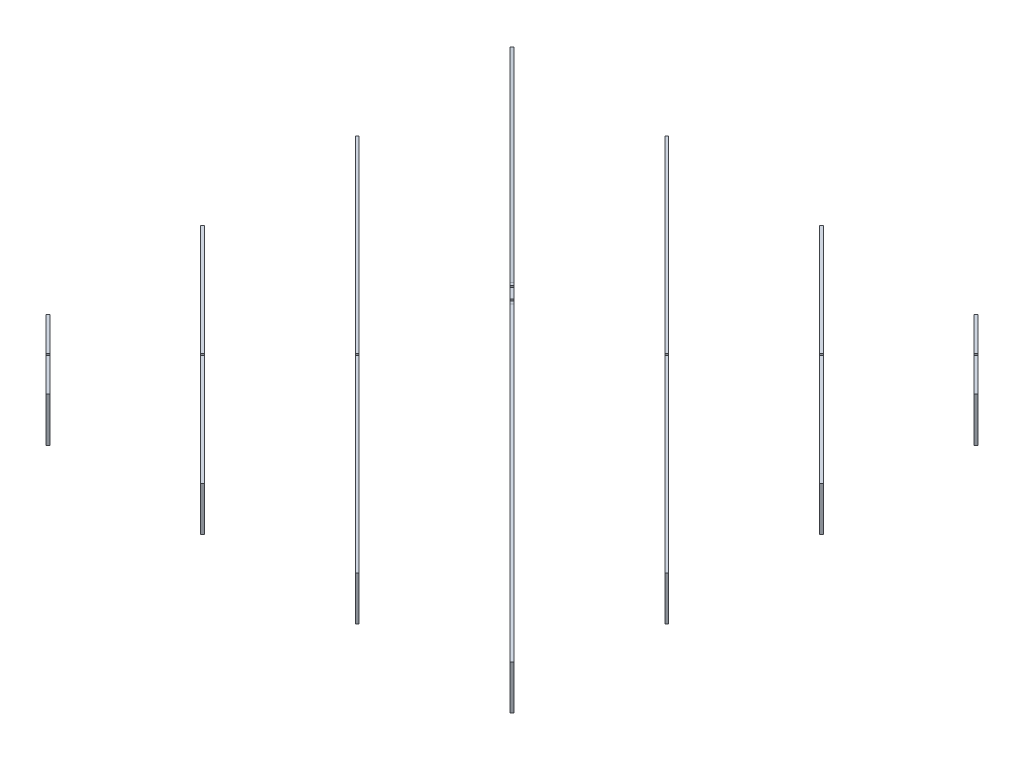
from build123d import *
from OCP.BRepAlgoAPI import BRepAlgoAPI_Cut
from OCP.TopTools import TopTools_ListOfShape

# Parameters (mm, degrees)
BOSS_EXTRUDE1_DEPTH   = 100
BOSS_EXTRUDE1_2_DEPTH = 100
BOSS_EXTRUDE1_3_DEPTH = 100
BOSS_EXTRUDE1_4_DEPTH = 100
BOSS_EXTRUDE1_5_DEPTH = 100
BOSS_EXTRUDE1_6_DEPTH = 100
BOSS_EXTRUDE1_7_DEPTH = 100
BOSS_EXTRUDE2_START   = -6
BOSS_EXTRUDE2_DEPTH   = 6
SKETCH5_R             = 1.5
SKETCH5_W             = 6
SKETCH5_H             = 100
CUT_EXTRUDE2_DEPTH    = 1617.105617821
CUT_EXTRUDE3_START    = -1490.92424
CUT_EXTRUDE3_DEPTH    = 500.97474683
CUT_EXTRUDE4_DEPTH    = 500.974746831
CUT_EXTRUDE5_DEPTH    = 6
CUT_EXTRUDE6_DEPTH    = 887.33661508
SKETCH11_W            = 56
SKETCH11_H            = 12
CUT_EXTRUDE7_DEPTH    = 6
SKETCH12_R            = 4
SKETCH12_R_2          = 10
CUT_EXTRUDE8_DEPTH    = 6
CUT_EXTRUDE9_START    = -6
SKETCH13_R            = 3
CUT_EXTRUDE9_DEPTH    = 253.487373416


with BuildPart() as part:
    # Sketch2 → Boss-Extrude1 (new body)
    with BuildSketch(Plane(origin=(0, 0, 0), x_dir=(1, 0, 0), z_dir=(0, 1, 0))):
        Polygon((-605, -449.242640687), (-449.242640687, -605), (-445, -600.757359313), (-600.757359313, -445), align=None)
    extrude(amount=BOSS_EXTRUDE1_DEPTH)


with BuildPart() as body_2:
    # Sketch2 → Boss-Extrude1 2 (new body)
    with BuildSketch(Plane(origin=(0, 0, 0), x_dir=(1, 0, 0), z_dir=(0, 1, 0))):
        Polygon((-605, -99.242640687), (-99.242640687, -605), (-95, -600.757359313), (-600.757359313, -95), align=None)
    extrude(amount=BOSS_EXTRUDE1_2_DEPTH)


with BuildPart() as body_3:
    # Sketch2 → Boss-Extrude1 3 (new body)
    with BuildSketch(Plane(origin=(0, 0, 0), x_dir=(1, 0, 0), z_dir=(0, 1, 0))):
        Polygon((-605, 250.757359313), (250.757359313, -605), (255, -600.757359313), (-600.757359313, 255), align=None)
    extrude(amount=BOSS_EXTRUDE1_3_DEPTH)


with BuildPart() as body_4:
    # Sketch2 → Boss-Extrude1 4 (new body)
    with BuildSketch(Plane(origin=(0, 0, 0), x_dir=(1, 0, 0), z_dir=(0, 1, 0))):
        Polygon((605, -600.757359313), (-600.757359313, 605), (-605, 600.757359313), (600.757359313, -605), align=None)
    extrude(amount=BOSS_EXTRUDE1_4_DEPTH)

    # Sketch4 → Boss-Extrude2 (add)
    with BuildSketch(Plane(origin=(-2.121320344, 0, 2.121320344), x_dir=(0.7071067811865475, 0, 0.7071067811865477), z_dir=(-0.7071067811865477, 0, 0.7071067811865475)).offset(BOSS_EXTRUDE2_START)):
        Polygon((-30, 220), (-852.599205236, 100), (-30, 100), (30, 100), (852.599205236, 100), (30, 220), align=None)
    extrude(amount=BOSS_EXTRUDE2_DEPTH)


with BuildPart() as body_5:
    # Sketch2 → Boss-Extrude1 5 (new body)
    with BuildSketch(Plane(origin=(0, 0, 0), x_dir=(1, 0, 0), z_dir=(0, 1, 0))):
        Polygon((-255, 600.757359313), (600.757359313, -255), (605, -250.757359313), (-250.757359313, 605), align=None)
    extrude(amount=BOSS_EXTRUDE1_5_DEPTH)


with BuildPart() as body_6:
    # Sketch2 → Boss-Extrude1 6 (new body)
    with BuildSketch(Plane(origin=(0, 0, 0), x_dir=(1, 0, 0), z_dir=(0, 1, 0))):
        Polygon((95, 600.757359313), (600.757359313, 95), (605, 99.242640687), (99.242640687, 605), align=None)
    extrude(amount=BOSS_EXTRUDE1_6_DEPTH)


with BuildPart() as body_7:
    # Sketch2 → Boss-Extrude1 7 (new body)
    with BuildSketch(Plane(origin=(0, 0, 0), x_dir=(1, 0, 0), z_dir=(0, 1, 0))):
        Polygon((445, 600.757359313), (600.757359313, 445), (605, 449.242640687), (449.242640687, 605), align=None)
    extrude(amount=BOSS_EXTRUDE1_7_DEPTH)


with BuildPart() as cut_extrude2_tool:
    # Sketch5 → Cut-Extrude2 (new, through all)
    with BuildSketch(Plane(origin=(-527.121320344, 0, 527.121320344), x_dir=(0.707106781186544, 0, 0.7071067811865511), z_dir=(-0.7071067811865511, 0, 0.707106781186544))):
        with BuildLine():
            Line((-745.462120246, 48.5), (-745.462120246, 50))
            Line((-745.462120246, 50), (-743.962120246, 50))
            ThreePointArc((-743.962120246, 50), (-746.522780418, 51.060660172), (-745.462120246, 48.5))
        make_face()
        with BuildLine():
            Line((-743.962120246, 50), (-745.462120246, 50))
            Line((-745.462120246, 50), (-745.462120246, 48.5))
            ThreePointArc((-745.462120246, 48.5), (-744.401460074, 48.939339828), (-743.962120246, 50))
        make_face()
        with BuildLine():
            ThreePointArc((-737.962120246, 50), (-739.462120246, 51.5), (-740.962120246, 50))
            Line((-740.962120246, 50), (-739.462120246, 50))
            Line((-739.462120246, 50), (-739.462120246, 48.5))
            ThreePointArc((-739.462120246, 48.5), (-738.401460074, 48.939339828), (-737.962120246, 50))
        make_face()
        with BuildLine():
            Line((-739.462120246, 50), (-740.962120246, 50))
            ThreePointArc((-740.962120246, 50), (-740.522780418, 48.939339828), (-739.462120246, 48.5))
            Line((-739.462120246, 48.5), (-739.462120246, 50))
        make_face()
        with BuildLine():
            ThreePointArc((-737.962120246, 50), (-739.462120246, 51.5), (-740.962120246, 50))
            Line((-740.962120246, 50), (-739.462120246, 50))
            Line((-739.462120246, 50), (-739.462120246, 48.5))
            ThreePointArc((-739.462120246, 48.5), (-738.401460074, 48.939339828), (-737.962120246, 50))
        make_face()
        with BuildLine():
            Line((-739.462120246, 50), (-740.962120246, 50))
            ThreePointArc((-740.962120246, 50), (-740.522780418, 48.939339828), (-739.462120246, 48.5))
            Line((-739.462120246, 48.5), (-739.462120246, 50))
        make_face()
        with BuildLine():
            Line((-745.462120246, 48.5), (-745.462120246, 50))
            Line((-745.462120246, 50), (-743.962120246, 50))
            ThreePointArc((-743.962120246, 50), (-746.522780418, 51.060660172), (-745.462120246, 48.5))
        make_face()
        with BuildLine():
            Line((-743.962120246, 50), (-745.462120246, 50))
            Line((-745.462120246, 50), (-745.462120246, 48.5))
            ThreePointArc((-745.462120246, 48.5), (-744.401460074, 48.939339828), (-743.962120246, 50))
        make_face()
        with Locations((-739.462120246, 50)):
            Circle(SKETCH5_R)
        with Locations((-745.462120246, 50)):
            Circle(SKETCH5_R)
        with Locations((-742.462120246, 0)):
            Rectangle(SKETCH5_W, SKETCH5_H)
        with BuildLine():
            ThreePointArc((-490.474746831, 50), (-491.974746831, 51.5), (-493.474746831, 50))
            Line((-493.474746831, 50), (-491.974746831, 50))
            Line((-491.974746831, 50), (-491.974746831, 48.5))
            ThreePointArc((-491.974746831, 48.5), (-490.914086659, 48.939339828), (-490.474746831, 50))
        make_face()
        with BuildLine():
            Line((-491.974746831, 50), (-493.474746831, 50))
            ThreePointArc((-493.474746831, 50), (-493.035407002, 48.939339828), (-491.974746831, 48.5))
            Line((-491.974746831, 48.5), (-491.974746831, 50))
        make_face()
        with BuildLine():
            ThreePointArc((-490.474746831, 50), (-491.974746831, 51.5), (-493.474746831, 50))
            Line((-493.474746831, 50), (-491.974746831, 50))
            Line((-491.974746831, 50), (-491.974746831, 48.5))
            ThreePointArc((-491.974746831, 48.5), (-490.914086659, 48.939339828), (-490.474746831, 50))
        make_face()
        with BuildLine():
            Line((-491.974746831, 50), (-493.474746831, 50))
            ThreePointArc((-493.474746831, 50), (-493.035407002, 48.939339828), (-491.974746831, 48.5))
            Line((-491.974746831, 48.5), (-491.974746831, 50))
        make_face()
        with Locations((-491.974746831, 50)):
            Circle(SKETCH5_R)
        with Locations((-497.974746831, 50)):
            Circle(SKETCH5_R)
        with Locations((-494.974746831, 0)):
            Rectangle(SKETCH5_W, SKETCH5_H)
        with BuildLine():
            Line((-497.974746831, 48.5), (-497.974746831, 50))
            Line((-497.974746831, 50), (-496.474746831, 50))
            ThreePointArc((-496.474746831, 50), (-499.035407002, 51.060660172), (-497.974746831, 48.5))
        make_face()
        with BuildLine():
            Line((-496.474746831, 50), (-497.974746831, 50))
            Line((-497.974746831, 50), (-497.974746831, 48.5))
            ThreePointArc((-497.974746831, 48.5), (-496.914086659, 48.939339828), (-496.474746831, 50))
        make_face()
        with BuildLine():
            Line((-497.974746831, 48.5), (-497.974746831, 50))
            Line((-497.974746831, 50), (-496.474746831, 50))
            ThreePointArc((-496.474746831, 50), (-499.035407002, 51.060660172), (-497.974746831, 48.5))
        make_face()
        with BuildLine():
            Line((-496.474746831, 50), (-497.974746831, 50))
            Line((-497.974746831, 50), (-497.974746831, 48.5))
            ThreePointArc((-497.974746831, 48.5), (-496.914086659, 48.939339828), (-496.474746831, 50))
        make_face()
        with BuildLine():
            Line((-250.487373415, 48.5), (-250.487373415, 50))
            Line((-250.487373415, 50), (-248.987373415, 50))
            ThreePointArc((-248.987373415, 50), (-251.548033587, 51.060660172), (-250.487373415, 48.5))
        make_face()
        with BuildLine():
            Line((-248.987373415, 50), (-250.487373415, 50))
            Line((-250.487373415, 50), (-250.487373415, 48.5))
            ThreePointArc((-250.487373415, 48.5), (-249.426713244, 48.939339828), (-248.987373415, 50))
        make_face()
        with BuildLine():
            ThreePointArc((-242.987373415, 50), (-244.487373415, 51.5), (-245.987373415, 50))
            Line((-245.987373415, 50), (-244.487373415, 50))
            Line((-244.487373415, 50), (-244.487373415, 48.5))
            ThreePointArc((-244.487373415, 48.5), (-243.426713244, 48.939339828), (-242.987373415, 50))
        make_face()
        with BuildLine():
            Line((-244.487373415, 50), (-245.987373415, 50))
            ThreePointArc((-245.987373415, 50), (-245.548033587, 48.939339828), (-244.487373415, 48.5))
            Line((-244.487373415, 48.5), (-244.487373415, 50))
        make_face()
        with BuildLine():
            ThreePointArc((-242.987373415, 50), (-244.487373415, 51.5), (-245.987373415, 50))
            Line((-245.987373415, 50), (-244.487373415, 50))
            Line((-244.487373415, 50), (-244.487373415, 48.5))
            ThreePointArc((-244.487373415, 48.5), (-243.426713244, 48.939339828), (-242.987373415, 50))
        make_face()
        with BuildLine():
            Line((-244.487373415, 50), (-245.987373415, 50))
            ThreePointArc((-245.987373415, 50), (-245.548033587, 48.939339828), (-244.487373415, 48.5))
            Line((-244.487373415, 48.5), (-244.487373415, 50))
        make_face()
        with BuildLine():
            Line((-250.487373415, 48.5), (-250.487373415, 50))
            Line((-250.487373415, 50), (-248.987373415, 50))
            ThreePointArc((-248.987373415, 50), (-251.548033587, 51.060660172), (-250.487373415, 48.5))
        make_face()
        with BuildLine():
            Line((-248.987373415, 50), (-250.487373415, 50))
            Line((-250.487373415, 50), (-250.487373415, 48.5))
            ThreePointArc((-250.487373415, 48.5), (-249.426713244, 48.939339828), (-248.987373415, 50))
        make_face()
        with Locations((-244.487373415, 50)):
            Circle(SKETCH5_R)
        with Locations((-250.487373415, 50)):
            Circle(SKETCH5_R)
        with Locations((-247.487373415, 0)):
            Rectangle(SKETCH5_W, SKETCH5_H)
        with BuildLine():
            Line((245.987373415, 50), (244.487373415, 50))
            Line((244.487373415, 50), (244.487373415, 48.5))
            ThreePointArc((244.487373415, 48.5), (245.548033587, 48.939339828), (245.987373415, 50))
        make_face()
        with BuildLine():
            Line((244.487373415, 48.5), (244.487373415, 50))
            Line((244.487373415, 50), (245.987373415, 50))
            ThreePointArc((245.987373415, 50), (243.426713244, 51.060660172), (244.487373415, 48.5))
        make_face()
        with BuildLine():
            Line((245.987373415, 50), (244.487373415, 50))
            Line((244.487373415, 50), (244.487373415, 48.5))
            ThreePointArc((244.487373415, 48.5), (245.548033587, 48.939339828), (245.987373415, 50))
        make_face()
        with BuildLine():
            Line((244.487373415, 48.5), (244.487373415, 50))
            Line((244.487373415, 50), (245.987373415, 50))
            ThreePointArc((245.987373415, 50), (243.426713244, 51.060660172), (244.487373415, 48.5))
        make_face()
        with Locations((250.487373415, 50)):
            Circle(SKETCH5_R)
        with Locations((244.487373415, 50)):
            Circle(SKETCH5_R)
        with Locations((247.487373415, 0)):
            Rectangle(SKETCH5_W, SKETCH5_H)
        with BuildLine():
            ThreePointArc((251.987373415, 50), (250.487373415, 51.5), (248.987373415, 50))
            Line((248.987373415, 50), (250.487373415, 50))
            Line((250.487373415, 50), (250.487373415, 48.5))
            ThreePointArc((250.487373415, 48.5), (251.548033587, 48.939339828), (251.987373415, 50))
        make_face()
        with BuildLine():
            Line((250.487373415, 50), (248.987373415, 50))
            ThreePointArc((248.987373415, 50), (249.426713244, 48.939339828), (250.487373415, 48.5))
            Line((250.487373415, 48.5), (250.487373415, 50))
        make_face()
        with BuildLine():
            ThreePointArc((251.987373415, 50), (250.487373415, 51.5), (248.987373415, 50))
            Line((248.987373415, 50), (250.487373415, 50))
            Line((250.487373415, 50), (250.487373415, 48.5))
            ThreePointArc((250.487373415, 48.5), (251.548033587, 48.939339828), (251.987373415, 50))
        make_face()
        with BuildLine():
            Line((250.487373415, 50), (248.987373415, 50))
            ThreePointArc((248.987373415, 50), (249.426713244, 48.939339828), (250.487373415, 48.5))
            Line((250.487373415, 48.5), (250.487373415, 50))
        make_face()
        with BuildLine():
            Line((493.474746831, 50), (491.974746831, 50))
            Line((491.974746831, 50), (491.974746831, 48.5))
            ThreePointArc((491.974746831, 48.5), (493.035407002, 48.939339828), (493.474746831, 50))
        make_face()
        with BuildLine():
            Line((491.974746831, 48.5), (491.974746831, 50))
            Line((491.974746831, 50), (493.474746831, 50))
            ThreePointArc((493.474746831, 50), (490.914086659, 51.060660172), (491.974746831, 48.5))
        make_face()
        with BuildLine():
            Line((493.474746831, 50), (491.974746831, 50))
            Line((491.974746831, 50), (491.974746831, 48.5))
            ThreePointArc((491.974746831, 48.5), (493.035407002, 48.939339828), (493.474746831, 50))
        make_face()
        with BuildLine():
            Line((491.974746831, 48.5), (491.974746831, 50))
            Line((491.974746831, 50), (493.474746831, 50))
            ThreePointArc((493.474746831, 50), (490.914086659, 51.060660172), (491.974746831, 48.5))
        make_face()
        with Locations((497.974746831, 50)):
            Circle(SKETCH5_R)
        with Locations((491.974746831, 50)):
            Circle(SKETCH5_R)
        with Locations((494.974746831, 0)):
            Rectangle(SKETCH5_W, SKETCH5_H)
        with BuildLine():
            ThreePointArc((499.474746831, 50), (497.974746831, 51.5), (496.474746831, 50))
            Line((496.474746831, 50), (497.974746831, 50))
            Line((497.974746831, 50), (497.974746831, 48.5))
            ThreePointArc((497.974746831, 48.5), (499.035407002, 48.939339828), (499.474746831, 50))
        make_face()
        with BuildLine():
            Line((497.974746831, 50), (496.474746831, 50))
            ThreePointArc((496.474746831, 50), (496.914086659, 48.939339828), (497.974746831, 48.5))
            Line((497.974746831, 48.5), (497.974746831, 50))
        make_face()
        with BuildLine():
            ThreePointArc((499.474746831, 50), (497.974746831, 51.5), (496.474746831, 50))
            Line((496.474746831, 50), (497.974746831, 50))
            Line((497.974746831, 50), (497.974746831, 48.5))
            ThreePointArc((497.974746831, 48.5), (499.035407002, 48.939339828), (499.474746831, 50))
        make_face()
        with BuildLine():
            Line((497.974746831, 50), (496.474746831, 50))
            ThreePointArc((496.474746831, 50), (496.914086659, 48.939339828), (497.974746831, 48.5))
            Line((497.974746831, 48.5), (497.974746831, 50))
        make_face()
        with BuildLine():
            Line((740.962120246, 50), (739.462120246, 50))
            Line((739.462120246, 50), (739.462120246, 48.5))
            ThreePointArc((739.462120246, 48.5), (740.522780418, 48.939339828), (740.962120246, 50))
        make_face()
        with BuildLine():
            Line((739.462120246, 48.5), (739.462120246, 50))
            Line((739.462120246, 50), (740.962120246, 50))
            ThreePointArc((740.962120246, 50), (738.401460074, 51.060660172), (739.462120246, 48.5))
        make_face()
        with BuildLine():
            Line((740.962120246, 50), (739.462120246, 50))
            Line((739.462120246, 50), (739.462120246, 48.5))
            ThreePointArc((739.462120246, 48.5), (740.522780418, 48.939339828), (740.962120246, 50))
        make_face()
        with BuildLine():
            Line((739.462120246, 48.5), (739.462120246, 50))
            Line((739.462120246, 50), (740.962120246, 50))
            ThreePointArc((740.962120246, 50), (738.401460074, 51.060660172), (739.462120246, 48.5))
        make_face()
        with Locations((745.462120246, 50)):
            Circle(SKETCH5_R)
        with Locations((739.462120246, 50)):
            Circle(SKETCH5_R)
        with Locations((742.462120246, 0)):
            Rectangle(SKETCH5_W, SKETCH5_H)
        with BuildLine():
            ThreePointArc((746.962120246, 50), (745.462120246, 51.5), (743.962120246, 50))
            Line((743.962120246, 50), (745.462120246, 50))
            Line((745.462120246, 50), (745.462120246, 48.5))
            ThreePointArc((745.462120246, 48.5), (746.522780418, 48.939339828), (746.962120246, 50))
        make_face()
        with BuildLine():
            Line((745.462120246, 50), (743.962120246, 50))
            ThreePointArc((743.962120246, 50), (744.401460074, 48.939339828), (745.462120246, 48.5))
            Line((745.462120246, 48.5), (745.462120246, 50))
        make_face()
        with BuildLine():
            ThreePointArc((746.962120246, 50), (745.462120246, 51.5), (743.962120246, 50))
            Line((743.962120246, 50), (745.462120246, 50))
            Line((745.462120246, 50), (745.462120246, 48.5))
            ThreePointArc((745.462120246, 48.5), (746.522780418, 48.939339828), (746.962120246, 50))
        make_face()
        with BuildLine():
            Line((745.462120246, 50), (743.962120246, 50))
            ThreePointArc((743.962120246, 50), (744.401460074, 48.939339828), (745.462120246, 48.5))
            Line((745.462120246, 48.5), (745.462120246, 50))
        make_face()
    extrude(amount=-CUT_EXTRUDE2_DEPTH)


with BuildPart() as body_2_1:
    add(body_2.part)

    # Cut-Extrude2: cut by cut_extrude2_tool
    add(cut_extrude2_tool.part, mode=Mode.SUBTRACT)


with BuildPart() as body_3_1:
    add(body_3.part)

    # Cut-Extrude2: cut by cut_extrude2_tool
    add(cut_extrude2_tool.part, mode=Mode.SUBTRACT)


with BuildPart() as body_4_1:
    add(body_4.part)

    # Cut-Extrude2: cut by cut_extrude2_tool
    add(cut_extrude2_tool.part, mode=Mode.SUBTRACT)

    # Sketch9 → Cut-Extrude5 (cut)
    with BuildSketch(Plane(origin=(-2.121320344, 0, 2.121320344), x_dir=(0.7071067811865475, 0, 0.7071067811865477), z_dir=(-0.7071067811865477, 0, 0.7071067811865475))):
        with BuildLine():
            Line((-3, 108.5), (-3, 0))
            Line((-3, 0), (3, 0))
            Line((3, 0), (3, 108.5))
            ThreePointArc((3, 108.5), (1.939339828, 108.939339828), (1.5, 110))
            Line((1.5, 110), (-1.5, 110))
            ThreePointArc((-1.5, 110), (-1.939339828, 108.939339828), (-3, 108.5))
        make_face()
        with BuildLine():
            ThreePointArc((1.5, 110), (1.939339828, 108.939339828), (3, 108.5))
            Line((3, 108.5), (3, 110))
            Line((3, 110), (1.5, 110))
        make_face()
        with BuildLine():
            Line((3, 110), (3, 108.5))
            ThreePointArc((3, 108.5), (4.060660172, 108.939339828), (4.5, 110))
            ThreePointArc((4.5, 110), (3, 111.5), (1.5, 110))
            Line((1.5, 110), (3, 110))
        make_face()
        with BuildLine():
            ThreePointArc((-1.5, 110), (-4.060660172, 111.060660172), (-3, 108.5))
            Line((-3, 108.5), (-3, 110))
            Line((-3, 110), (-1.5, 110))
        make_face()
        with BuildLine():
            Line((-3, 110), (-3, 108.5))
            ThreePointArc((-3, 108.5), (-1.939339828, 108.939339828), (-1.5, 110))
            Line((-1.5, 110), (-3, 110))
        make_face()
        with BuildLine():
            ThreePointArc((-1.5, 110), (-4.060660172, 111.060660172), (-3, 108.5))
            Line((-3, 108.5), (-3, 110))
            Line((-3, 110), (-1.5, 110))
        make_face()
        with BuildLine():
            Line((-3, 110), (-3, 108.5))
            ThreePointArc((-3, 108.5), (-1.939339828, 108.939339828), (-1.5, 110))
            Line((-1.5, 110), (-3, 110))
        make_face()
        with BuildLine():
            ThreePointArc((1.5, 110), (1.939339828, 108.939339828), (3, 108.5))
            Line((3, 108.5), (3, 110))
            Line((3, 110), (1.5, 110))
        make_face()
        with BuildLine():
            Line((3, 110), (3, 108.5))
            ThreePointArc((3, 108.5), (4.060660172, 108.939339828), (4.5, 110))
            ThreePointArc((4.5, 110), (3, 111.5), (1.5, 110))
            Line((1.5, 110), (3, 110))
        make_face()
    extrude(amount=-CUT_EXTRUDE5_DEPTH, mode=Mode.SUBTRACT)

    # Sketch10 → Cut-Extrude6 (cut, through all)
    with BuildSketch(Plane(origin=(-2.121320344, 0, 2.121320344), x_dir=(0.7071067811865475, 0, 0.7071067811865477), z_dir=(-0.7071067811865477, 0, 0.7071067811865475))):
        with BuildLine():
            ThreePointArc((22, 201.5), (20.939339828, 201.060660172), (20.5, 200))
            Line((20.5, 200), (22, 200))
            Line((22, 200), (22, 201.5))
        make_face()
        with BuildLine():
            Line((22, 200), (20.5, 200))
            ThreePointArc((20.5, 200), (22, 198.5), (23.5, 200))
            ThreePointArc((23.5, 200), (23.060660172, 201.060660172), (22, 201.5))
            Line((22, 201.5), (22, 200))
        make_face()
        with BuildLine():
            ThreePointArc((22, 201.5), (20.939339828, 201.060660172), (20.5, 200))
            Line((20.5, 200), (22, 200))
            Line((22, 200), (22, 201.5))
        make_face()
        with BuildLine():
            Line((22, 200), (20.5, 200))
            ThreePointArc((20.5, 200), (22, 198.5), (23.5, 200))
            ThreePointArc((23.5, 200), (23.060660172, 201.060660172), (22, 201.5))
            Line((22, 201.5), (22, 200))
        make_face()
        with BuildLine():
            ThreePointArc((16, 201.5), (17.060660172, 201.060660172), (17.5, 200))
            Line((17.5, 200), (20.5, 200))
            ThreePointArc((20.5, 200), (20.939339828, 201.060660172), (22, 201.5))
            Line((22, 201.5), (22, 220))
            Line((22, 220), (16, 220))
            Line((16, 220), (16, 201.5))
        make_face()
        with BuildLine():
            Line((16, 201.5), (16, 200))
            Line((16, 200), (17.5, 200))
            ThreePointArc((17.5, 200), (17.060660172, 201.060660172), (16, 201.5))
        make_face()
        with BuildLine():
            Line((17.5, 200), (16, 200))
            Line((16, 200), (16, 201.5))
            ThreePointArc((16, 201.5), (14.939339828, 198.939339828), (17.5, 200))
        make_face()
        with BuildLine():
            Line((16, 201.5), (16, 200))
            Line((16, 200), (17.5, 200))
            ThreePointArc((17.5, 200), (17.060660172, 201.060660172), (16, 201.5))
        make_face()
        with BuildLine():
            Line((17.5, 200), (16, 200))
            Line((16, 200), (16, 201.5))
            ThreePointArc((16, 201.5), (14.939339828, 198.939339828), (17.5, 200))
        make_face()
        with BuildLine():
            ThreePointArc((-14.5, 200), (-14.939339828, 201.060660172), (-16, 201.5))
            Line((-16, 201.5), (-16, 200))
            Line((-16, 200), (-17.5, 200))
            ThreePointArc((-17.5, 200), (-16, 198.5), (-14.5, 200))
        make_face()
        with BuildLine():
            Line((-16, 200), (-16, 201.5))
            ThreePointArc((-16, 201.5), (-17.060660172, 201.060660172), (-17.5, 200))
            Line((-17.5, 200), (-16, 200))
        make_face()
        with BuildLine():
            ThreePointArc((-14.5, 200), (-14.939339828, 201.060660172), (-16, 201.5))
            Line((-16, 201.5), (-16, 200))
            Line((-16, 200), (-17.5, 200))
            ThreePointArc((-17.5, 200), (-16, 198.5), (-14.5, 200))
        make_face()
        with BuildLine():
            Line((-16, 200), (-16, 201.5))
            ThreePointArc((-16, 201.5), (-17.060660172, 201.060660172), (-17.5, 200))
            Line((-17.5, 200), (-16, 200))
        make_face()
        with BuildLine():
            Line((-16, 201.5), (-16, 220))
            Line((-16, 220), (-22, 220))
            Line((-22, 220), (-22, 201.5))
            ThreePointArc((-22, 201.5), (-20.939339828, 201.060660172), (-20.5, 200))
            Line((-20.5, 200), (-17.5, 200))
            ThreePointArc((-17.5, 200), (-17.060660172, 201.060660172), (-16, 201.5))
        make_face()
        with BuildLine():
            ThreePointArc((-20.5, 200), (-20.939339828, 201.060660172), (-22, 201.5))
            Line((-22, 201.5), (-22, 200))
            Line((-22, 200), (-20.5, 200))
        make_face()
        with BuildLine():
            Line((-22, 200), (-22, 201.5))
            ThreePointArc((-22, 201.5), (-23.060660172, 198.939339828), (-20.5, 200))
            Line((-20.5, 200), (-22, 200))
        make_face()
        with BuildLine():
            ThreePointArc((-20.5, 200), (-20.939339828, 201.060660172), (-22, 201.5))
            Line((-22, 201.5), (-22, 200))
            Line((-22, 200), (-20.5, 200))
        make_face()
        with BuildLine():
            Line((-22, 200), (-22, 201.5))
            ThreePointArc((-22, 201.5), (-23.060660172, 198.939339828), (-20.5, 200))
            Line((-20.5, 200), (-22, 200))
        make_face()
    extrude(amount=-CUT_EXTRUDE6_DEPTH, mode=Mode.SUBTRACT)

    # Sketch11 → Cut-Extrude7 (cut)
    with BuildSketch(Plane(origin=(-2.121320344, 0, 2.121320344), x_dir=(0.7071067811865475, 0, 0.7071067811865477), z_dir=(-0.7071067811865477, 0, 0.7071067811865475))):
        with Locations((-371.231060123, 22)):
            Rectangle(SKETCH11_W, SKETCH11_H)
        with Locations((371.231060123, 22)):
            Rectangle(SKETCH11_W, SKETCH11_H)
    extrude(amount=-CUT_EXTRUDE7_DEPTH, mode=Mode.SUBTRACT)

    # Sketch12 → Cut-Extrude8 (cut)
    with BuildSketch(Plane(origin=(-2.121320344, 0, 2.121320344), x_dir=(0.7071067811865475, 0, 0.7071067811865477), z_dir=(-0.7071067811865477, 0, 0.7071067811865475))):
        with Locations((123.743686708, 64)):
            Circle(SKETCH12_R)
        with Locations((123.743686708, 84)):
            Circle(SKETCH12_R)
        with Locations((-123.743686708, 64)):
            Circle(SKETCH12_R)
        with Locations((-123.743686708, 84)):
            Circle(SKETCH12_R)
        with Locations((40, 74)):
            Circle(SKETCH12_R_2)
        with Locations((-40, 74)):
            Circle(SKETCH12_R_2)
    extrude(amount=-CUT_EXTRUDE8_DEPTH, mode=Mode.SUBTRACT)


with BuildPart() as body_5_1:
    add(body_5.part)

    # Cut-Extrude2: cut by cut_extrude2_tool
    add(cut_extrude2_tool.part, mode=Mode.SUBTRACT)


with BuildPart() as body_6_1:
    add(body_6.part)

    # Cut-Extrude2: cut by cut_extrude2_tool
    add(cut_extrude2_tool.part, mode=Mode.SUBTRACT)


with BuildPart() as cut_extrude3_tool:
    # Sketch6 → Cut-Extrude3 (new body)
    with BuildSketch(Plane(origin=(-527.121320344, 0, 527.121320344), x_dir=(0.707106781186544, 0, 0.7071067811865511), z_dir=(-0.7071067811865511, 0, 0.707106781186544)).offset(CUT_EXTRUDE3_START)):
        with BuildLine():
            Line((3, 100), (-3, 100))
            Line((-3, 100), (-3, 51.5))
            ThreePointArc((-3, 51.5), (-1.939339828, 51.060660172), (-1.5, 50))
            Line((-1.5, 50), (1.5, 50))
            ThreePointArc((1.5, 50), (1.939339828, 51.060660172), (3, 51.5))
            Line((3, 51.5), (3, 100))
        make_face()
        with BuildLine():
            ThreePointArc((4.5, 50), (4.060660172, 51.060660172), (3, 51.5))
            Line((3, 51.5), (3, 50))
            Line((3, 50), (1.5, 50))
            ThreePointArc((1.5, 50), (3, 48.5), (4.5, 50))
        make_face()
        with BuildLine():
            Line((3, 50), (3, 51.5))
            ThreePointArc((3, 51.5), (1.939339828, 51.060660172), (1.5, 50))
            Line((1.5, 50), (3, 50))
        make_face()
        with BuildLine():
            ThreePointArc((-1.5, 50), (-1.939339828, 51.060660172), (-3, 51.5))
            Line((-3, 51.5), (-3, 50))
            Line((-3, 50), (-1.5, 50))
        make_face()
        with BuildLine():
            Line((-3, 50), (-3, 51.5))
            ThreePointArc((-3, 51.5), (-4.060660172, 48.939339828), (-1.5, 50))
            Line((-1.5, 50), (-3, 50))
        make_face()
        with BuildLine():
            ThreePointArc((-1.5, 50), (-1.939339828, 51.060660172), (-3, 51.5))
            Line((-3, 51.5), (-3, 50))
            Line((-3, 50), (-1.5, 50))
        make_face()
        with BuildLine():
            Line((-3, 50), (-3, 51.5))
            ThreePointArc((-3, 51.5), (-4.060660172, 48.939339828), (-1.5, 50))
            Line((-1.5, 50), (-3, 50))
        make_face()
        with BuildLine():
            ThreePointArc((4.5, 50), (4.060660172, 51.060660172), (3, 51.5))
            Line((3, 51.5), (3, 50))
            Line((3, 50), (1.5, 50))
            ThreePointArc((1.5, 50), (3, 48.5), (4.5, 50))
        make_face()
        with BuildLine():
            Line((3, 50), (3, 51.5))
            ThreePointArc((3, 51.5), (1.939339828, 51.060660172), (1.5, 50))
            Line((1.5, 50), (3, 50))
        make_face()
    extrude(amount=CUT_EXTRUDE3_DEPTH)


with BuildPart() as body_5_2:
    add(body_5_1.part)

    # Cut-Extrude3: cut by cut_extrude3_tool, with a tolerance
    cut_extrude3_stock = TopTools_ListOfShape()
    cut_extrude3_stock.Append(body_5_2.part.wrapped)
    cut_extrude3_tools = TopTools_ListOfShape()
    cut_extrude3_tools.Append(cut_extrude3_tool.part.wrapped)
    cut_extrude3_cut = BRepAlgoAPI_Cut()
    cut_extrude3_cut.SetArguments(cut_extrude3_stock)
    cut_extrude3_cut.SetTools(cut_extrude3_tools)
    cut_extrude3_cut.SetFuzzyValue(0.00001)
    cut_extrude3_cut.Build()
    add(Compound.cast(cut_extrude3_cut.Shape()).solids(), mode=Mode.REPLACE)


with BuildPart() as body_6_2:
    add(body_6_1.part)

    # Cut-Extrude3: cut by cut_extrude3_tool, with a tolerance
    cut_extrude3_2_stock = TopTools_ListOfShape()
    cut_extrude3_2_stock.Append(body_6_2.part.wrapped)
    cut_extrude3_2_tools = TopTools_ListOfShape()
    cut_extrude3_2_tools.Append(cut_extrude3_tool.part.wrapped)
    cut_extrude3_2_cut = BRepAlgoAPI_Cut()
    cut_extrude3_2_cut.SetArguments(cut_extrude3_2_stock)
    cut_extrude3_2_cut.SetTools(cut_extrude3_2_tools)
    cut_extrude3_2_cut.SetFuzzyValue(0.00001)
    cut_extrude3_2_cut.Build()
    add(Compound.cast(cut_extrude3_2_cut.Shape()).solids(), mode=Mode.REPLACE)


with BuildPart() as body_7_1:
    add(body_7.part)

    # Cut-Extrude3: cut by cut_extrude3_tool, with a tolerance
    cut_extrude3_3_stock = TopTools_ListOfShape()
    cut_extrude3_3_stock.Append(body_7_1.part.wrapped)
    cut_extrude3_3_tools = TopTools_ListOfShape()
    cut_extrude3_3_tools.Append(cut_extrude3_tool.part.wrapped)
    cut_extrude3_3_cut = BRepAlgoAPI_Cut()
    cut_extrude3_3_cut.SetArguments(cut_extrude3_3_stock)
    cut_extrude3_3_cut.SetTools(cut_extrude3_3_tools)
    cut_extrude3_3_cut.SetFuzzyValue(0.00001)
    cut_extrude3_3_cut.Build()
    add(Compound.cast(cut_extrude3_3_cut.Shape()).solids(), mode=Mode.REPLACE)


with BuildPart() as cut_extrude4_tool:
    # Sketch8 → Cut-Extrude4 (new body)
    with BuildSketch(Plane(origin=(-527.121320344, 0, 527.121320344), x_dir=(0.707106781186544, 0, 0.7071067811865511), z_dir=(-0.7071067811865511, 0, 0.707106781186544))):
        with BuildLine():
            Line((3, 51.5), (3, 100))
            Line((3, 100), (-3, 100))
            Line((-3, 100), (-3, 51.5))
            ThreePointArc((-3, 51.5), (-1.939339828, 51.060660172), (-1.5, 50))
            Line((-1.5, 50), (1.5, 50))
            ThreePointArc((1.5, 50), (1.939339828, 51.060660172), (3, 51.5))
        make_face()
        with BuildLine():
            ThreePointArc((4.5, 50), (4.060660172, 51.060660172), (3, 51.5))
            Line((3, 51.5), (3, 50))
            Line((3, 50), (1.5, 50))
            ThreePointArc((1.5, 50), (3, 48.5), (4.5, 50))
        make_face()
        with BuildLine():
            Line((3, 50), (3, 51.5))
            ThreePointArc((3, 51.5), (1.939339828, 51.060660172), (1.5, 50))
            Line((1.5, 50), (3, 50))
        make_face()
        with BuildLine():
            ThreePointArc((-1.5, 50), (-1.939339828, 51.060660172), (-3, 51.5))
            Line((-3, 51.5), (-3, 50))
            Line((-3, 50), (-1.5, 50))
        make_face()
        with BuildLine():
            Line((-3, 50), (-3, 51.5))
            ThreePointArc((-3, 51.5), (-4.060660172, 48.939339828), (-1.5, 50))
            Line((-1.5, 50), (-3, 50))
        make_face()
        with BuildLine():
            ThreePointArc((-1.5, 50), (-1.939339828, 51.060660172), (-3, 51.5))
            Line((-3, 51.5), (-3, 50))
            Line((-3, 50), (-1.5, 50))
        make_face()
        with BuildLine():
            Line((-3, 50), (-3, 51.5))
            ThreePointArc((-3, 51.5), (-4.060660172, 48.939339828), (-1.5, 50))
            Line((-1.5, 50), (-3, 50))
        make_face()
        with BuildLine():
            ThreePointArc((4.5, 50), (4.060660172, 51.060660172), (3, 51.5))
            Line((3, 51.5), (3, 50))
            Line((3, 50), (1.5, 50))
            ThreePointArc((1.5, 50), (3, 48.5), (4.5, 50))
        make_face()
        with BuildLine():
            Line((3, 50), (3, 51.5))
            ThreePointArc((3, 51.5), (1.939339828, 51.060660172), (1.5, 50))
            Line((1.5, 50), (3, 50))
        make_face()
    extrude(amount=-CUT_EXTRUDE4_DEPTH)


with BuildPart() as part_1:
    add(part.part)

    # Cut-Extrude4: cut by cut_extrude4_tool
    add(cut_extrude4_tool.part, mode=Mode.SUBTRACT)


with BuildPart() as body_2_2:
    add(body_2_1.part)

    # Cut-Extrude4: cut by cut_extrude4_tool
    add(cut_extrude4_tool.part, mode=Mode.SUBTRACT)


with BuildPart() as body_3_2:
    add(body_3_1.part)

    # Cut-Extrude4: cut by cut_extrude4_tool
    add(cut_extrude4_tool.part, mode=Mode.SUBTRACT)


with BuildPart() as cut_extrude9_tool:
    # Sketch13 → Cut-Extrude9 (new body)
    with BuildSketch(Plane(origin=(177.121320344, 0, -177.121320344), x_dir=(-0.7071067811865512, 0, -0.7071067811865438), z_dir=(0.7071067811865438, 0, -0.7071067811865512)).offset(CUT_EXTRUDE9_START)):
        with Locations(Location((371.231060123, 50, 0), (0, 0, 180))):
            Circle(SKETCH13_R)
        with Locations(Location((123.743686707, 50, 0), (0, 0, 180))):
            Circle(SKETCH13_R)
        with Locations(Location((-123.743686708, 50, 0), (0, 0, 180))):
            Circle(SKETCH13_R)
        with Locations(Location((-371.231060123, 50, 0), (0, 0, 180))):
            Circle(SKETCH13_R)
    cut_extrude9 = extrude(amount=CUT_EXTRUDE9_DEPTH)


with BuildPart() as body_5_3:
    add(body_5_2.part)

    # Cut-Extrude9: cut by cut_extrude9_tool
    add(cut_extrude9_tool.part, mode=Mode.SUBTRACT)


with BuildPart() as body_6_3:
    add(body_6_2.part)

    # Cut-Extrude9: cut by cut_extrude9_tool
    add(cut_extrude9_tool.part, mode=Mode.SUBTRACT)


with BuildPart() as mirror1_tool:
    # Mirror1: Cut-Extrude9 across plane
    add(cut_extrude9.mirror(Plane(origin=(0, 0, 0), x_dir=(0.7071067811865476, 0, 0.7071067811865476), z_dir=(-0.7071067811865477, 0, 0.7071067811865475))))


with BuildPart() as body_2_3:
    add(body_2_2.part)

    # Mirror1: cut by mirror1_tool
    add(mirror1_tool.part, mode=Mode.SUBTRACT)


with BuildPart() as body_3_3:
    add(body_3_2.part)

    # Mirror1: cut by mirror1_tool
    add(mirror1_tool.part, mode=Mode.SUBTRACT)


solid = Compound([body_4_1.part, body_7_1.part, part_1.part, body_5_3.part, body_6_3.part, body_2_3.part, body_3_3.part])
